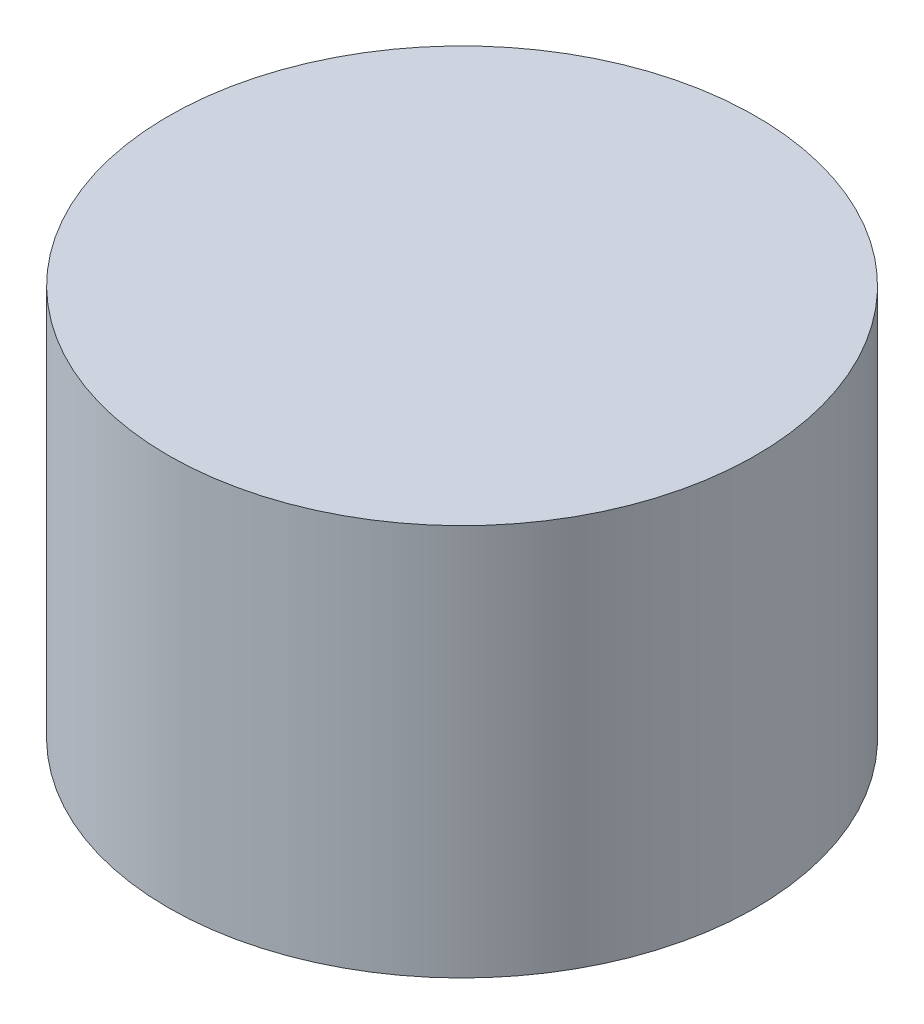
from build123d import *

# Parameters (mm, degrees)
SKETCH1_R           = 4.7625
BOSS_EXTRUDE1_DEPTH = 6.35


with BuildPart() as part:
    # Sketch1 → Boss-Extrude1 (new body)
    with BuildSketch(Plane(origin=(0, 0, 0), x_dir=(1, 0, 0), z_dir=(0, 1, 0))):
        Circle(SKETCH1_R)
    extrude(amount=BOSS_EXTRUDE1_DEPTH)


solid = part.part
